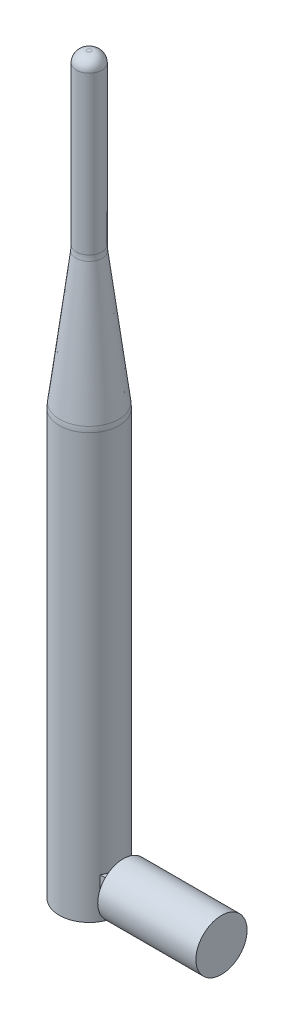
from build123d import *

# Parameters (mm, degrees)
SKETCH3_W           = 23
SKETCH3_H           = 6
SKETCH4_W           = 7
SKETCH4_H           = 7
BOSS_EXTRUDE2_DEPTH = 10


with BuildPart() as part:
    # Sketch2 → Antenna (revolve)
    with BuildSketch(Plane.XY):
        with BuildLine():
            Line((3, 169.5), (3, 132.622577483))
            ThreePointArc((3, 132.622577483), (3.019323979, 132.001203067), (3.077221233, 131.382230137))
            Line((3.077221233, 131.382230137), (6.922778767, 100.617769863))
            ThreePointArc((6.922778767, 100.617769863), (6.980676021, 99.998796933), (7, 99.377422517))
            Line((7, 99.377422517), (7, 0))
            Line((7, 0), (0, 0))
            Line((0, 0), (0, 172))
            Line((0, 172), (0.5, 172))
            ThreePointArc((0.5, 172), (2.267766953, 171.267766953), (3, 169.5))
        make_face()
    revolve(axis=Axis((0, 0, 0), (0, 1, 0)))



with BuildPart() as body_2:
    # Sketch3 → Revolve2 (revolve)
    with BuildSketch(Plane.XY):
        with Locations((19.5, 3)):
            Rectangle(SKETCH3_W, SKETCH3_H)
    revolve(axis=Axis((8, 6, 0), (1, 0, 0)))


with BuildPart() as part_1:
    add(part.part)

    add(body_2.part)  # Boss-Extrude2 merges body 2
    # Sketch4 → Boss-Extrude2 (add)
    with BuildSketch(Plane.ZY.offset(-8)):
        with Locations((0, 6)):
            Rectangle(SKETCH4_W, SKETCH4_H)
    extrude(amount=BOSS_EXTRUDE2_DEPTH)


solid = part_1.part
